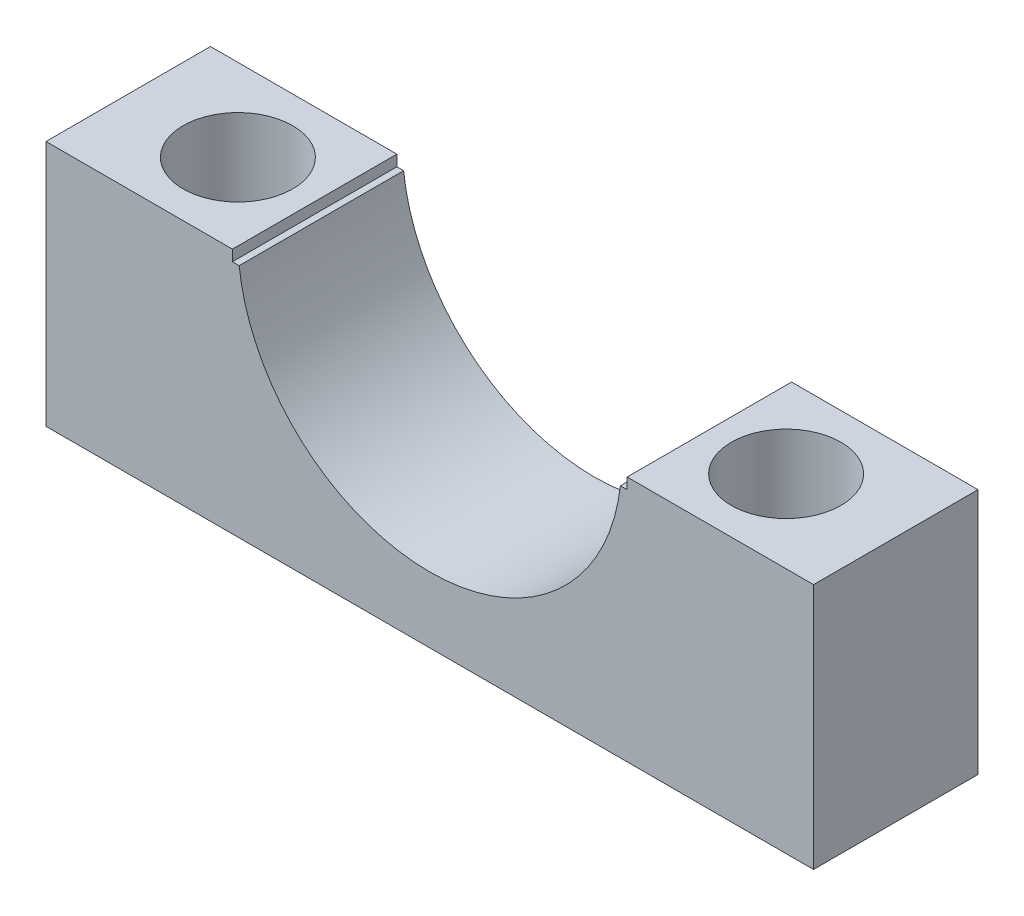
from build123d import *

# Parameters (mm, degrees)
BOSS_EXTRUDE1_DEPTH = 15
SKETCH2_R           = 5
CUT_EXTRUDE1_DEPTH  = 45.229515032


with BuildPart() as part:
    # Sketch1 → Boss-Extrude1 (new body)
    with BuildSketch(Plane.XY):
        with BuildLine():
            Line((35, 0), (-35, 0))
            Line((-35, 0), (-35, 22.5))
            Line((-35, 22.5), (-18, 22.5))
            Line((-18, 22.5), (-18, 21.5))
            Line((-18, 21.5), (-17.385338651, 21.5))
            ThreePointArc((-17.385338651, 21.5), (0, 6), (17.385338651, 21.5))
            Line((17.385338651, 21.5), (18, 21.5))
            Line((18, 21.5), (18, 22.5))
            Line((18, 22.5), (35, 22.5))
            Line((35, 22.5), (35, 0))
        make_face()
    extrude(amount=BOSS_EXTRUDE1_DEPTH)

    # Sketch2 → Cut-Extrude1 (cut, through all)
    with BuildSketch(Plane(origin=(0, 0, 0), x_dir=(1, 0, 0), z_dir=(0, 1, 0))):
        with Locations((-25, -7.5)):
            Circle(SKETCH2_R)
        with Locations((25, -7.5)):
            Circle(SKETCH2_R)
    extrude(amount=CUT_EXTRUDE1_DEPTH, mode=Mode.SUBTRACT)


solid = part.part
